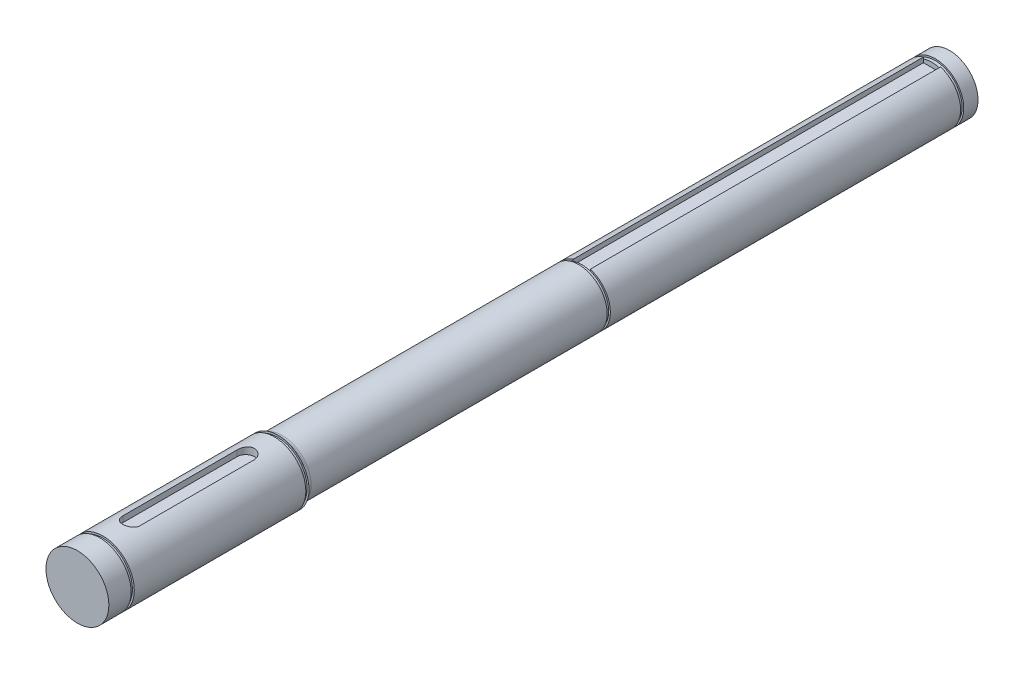
from build123d import *

# Parameters (mm, degrees)
SKETCH2_R           = 10
BOSS_EXTRUDE1_DEPTH = 235
SKETCH3_R           = 10
SKETCH3_R_2         = 9.43
CUT_EXTRUDE2_DEPTH  = 1.1
SKETCH4_W           = 6
SKETCH4_H           = 3.067792635
CUT_EXTRUDE3_DEPTH  = 61.25
SKETCH5_R           = 11
BOSS_EXTRUDE2_DEPTH = 70
FILLET3_R           = 2
SKETCH6_R           = 11
SKETCH6_R_2         = 10.35
CUT_EXTRUDE4_DEPTH  = 1.1
CUT_EXTRUDE5_DEPTH  = 2.5


with BuildPart() as part:
    # Sketch2 → Boss-Extrude1 (new body)
    with BuildSketch(Plane.XY):
        with Locations(Location((0, 0, 0), (0, 0, 180))):
            Circle(SKETCH2_R)
    extrude(amount=BOSS_EXTRUDE1_DEPTH)

    # Sketch3 → Cut-Extrude2 (cut)
    with BuildSketch(Plane(origin=(0, 0, 5), x_dir=(-1, 0, 0), z_dir=(0, 0, -1))):
        Circle(SKETCH3_R)
        Circle(SKETCH3_R_2, mode=Mode.SUBTRACT)
    cut_extrude2 = extrude(amount=-CUT_EXTRUDE2_DEPTH, mode=Mode.SUBTRACT)

    # Mirror1: Cut-Extrude2 across plane
    add(cut_extrude2.mirror(Plane(origin=(0, 0, 67.35), x_dir=(1, 0, 0), z_dir=(0, 0, -1))), mode=Mode.SUBTRACT)

    # Sketch4 → Cut-Extrude3 (cut, symmetric)
    with BuildSketch(Plane(origin=(0, 0, 67.35), x_dir=(-1, 0, 0), z_dir=(0, 0, -1))):
        with Locations((0, 9.343896318)):
            Rectangle(SKETCH4_W, SKETCH4_H)
    extrude(amount=CUT_EXTRUDE3_DEPTH, both=True, mode=Mode.SUBTRACT)

    # Sketch5 → Boss-Extrude2 (add)
    with BuildSketch(Plane.XY.offset(235)):
        Circle(SKETCH5_R)
    extrude(amount=BOSS_EXTRUDE2_DEPTH)

    # Fillet3
    # the kernel refuses this fillet: 2 mm, written as the material it adds along each edge
    with BuildSketch(Plane(origin=(0, 0, 235), x_dir=(-1, 0, 0), z_dir=(0, 1, 0))) as fillet3_piece_1:
        with BuildLine():
            CenterArc((12, -1.732050808), FILLET3_R, 120, 60)
            Line((10, -1.732050808), (9.96, -1.732050808))
            Line((9.96, -1.732050808), (9.96, 0))
            Line((9.96, 0), (10, 0.04))
            ThreePointArc((10, 0.04), (10.5, 0.04), (10.98, 0.034641016))
            Line((10.98, 0.034641016), (11, 0))
        make_face()
    revolve(axis=Axis((0, 0, 235), (0, 0, 1)))

    # Sketch6 → Cut-Extrude4 (cut)
    with BuildSketch(Plane.XY.offset(235)):
        Circle(SKETCH6_R)
        Circle(SKETCH6_R_2, mode=Mode.SUBTRACT)
    cut_extrude4 = extrude(amount=CUT_EXTRUDE4_DEPTH, mode=Mode.SUBTRACT)

    # Mirror2: Cut-Extrude4 across plane
    add(cut_extrude4.mirror(Plane.XY.offset(266.1)), mode=Mode.SUBTRACT)

    # Sketch8 → Cut-Extrude5 (cut)
    with BuildSketch(Plane(origin=(0, 11, 0), x_dir=(1, 0, 0), z_dir=(0, 1, 0))):
        with BuildLine():
            Line((3, -246.1), (3, -286.1))
            ThreePointArc((3, -286.1), (0, -289.1), (-3, -286.1))
            Line((-3, -286.1), (-3, -246.1))
            ThreePointArc((-3, -246.1), (0, -243.1), (3, -246.1))
        make_face()
    extrude(amount=-CUT_EXTRUDE5_DEPTH, mode=Mode.SUBTRACT)


solid = part.part
